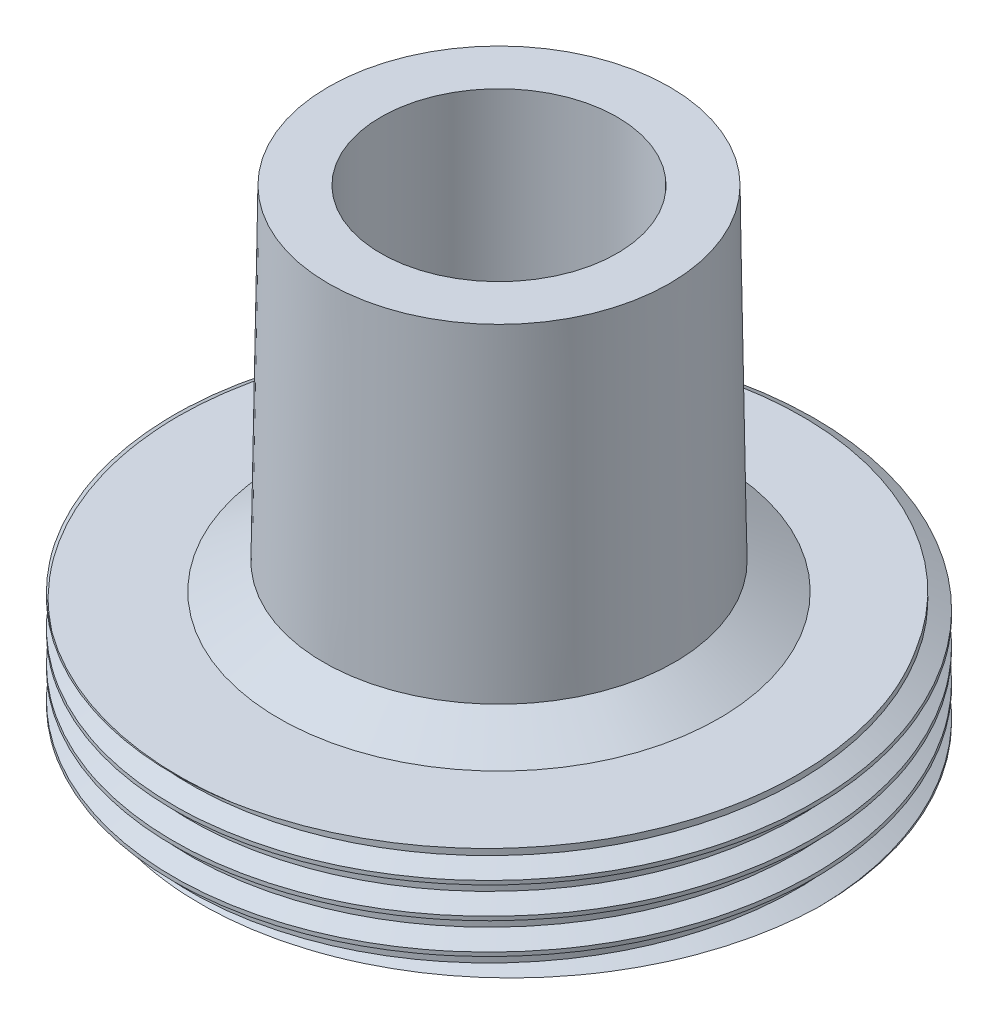
from build123d import *
from build123d.topology import SkipClean

# Parameters (mm, degrees)
SKETCH2_R           = 2.05
CUT_EXTRUDE1_DEPTH  = 37.683579433
CIRPATTERN1_COUNT   = 4
SKETCH3_R           = 3.8
SKETCH3_R_2         = 2.05
BOSS_EXTRUDE1_DEPTH = 3.5
THREAD1_PITCH       = 2


with BuildPart() as part:
    # Sketch1 → Revolve1 (revolve)
    with BuildSketch(Plane.XY, mode=Mode.PRIVATE) as revolve1_sk:
        Polygon((-20.65, 23.985086754), (-18.35, 23.985086754), (-18.35, 30.285086754), (-14.95, 30.285086754), (-14.95, 25.785086754), (-14.25, 25.785086754), (-11.85, 31.785086754), (0, 31.785086754), (0, 33.485086754), (-7.625, 33.485086754), (-7.625, 53.985086754), (-11, 53.985086754), (-11.322325581, 32.985086754), (-14.2, 31.285086754), (-20.65, 31.285086754), align=None)
    revolve(revolve1_sk.sketch.rotate(Axis((0, 0, 0), (0, 1, 0)), 270), axis=Axis((0, 0, 0), (0, 1, 0)))

    # Sketch2 → Cut-Extrude1 (cut, symmetric)
    with BuildSketch(Plane.XZ.offset(-31.785086754)):
        with Locations(Location((0, 0, 0), (0, 0, 270))):
            Circle(SKETCH2_R)
        with BuildLine():
            Line((1.1, 3.637306696), (1.1, 7.343066458))
            ThreePointArc((1.1, 7.343066458), (5.25026785, 5.25026785), (7.343066458, 1.1))
            Line((7.343066458, 1.1), (3.637306696, 1.1))
            ThreePointArc((3.637306696, 1.1), (2.687005769, 2.687005769), (1.1, 3.637306696))
        make_face()
    cut_extrude1 = extrude(amount=CUT_EXTRUDE1_DEPTH, both=True, mode=Mode.SUBTRACT)

    # CirPattern1: Cut-Extrude1 ×4 about axis
    cirpattern1_axis = Axis((0, 0, 0), (0, 1, 0))
    for i in range(1, CIRPATTERN1_COUNT):
        add(cut_extrude1.rotate(cirpattern1_axis, i * 360 / CIRPATTERN1_COUNT), mode=Mode.SUBTRACT)

    # Sketch3 → Boss-Extrude1 (add)
    with SkipClean():  # the faces are left unmerged after this step: merging them gives an invalid solid
        with BuildSketch(Plane(origin=(0, 33.485086754, 0), x_dir=(1, 0, 0), z_dir=(0, 1, 0))):
            with Locations(Location((0, 0, 0), (0, 0, 73.173551107))):
                Circle(SKETCH3_R)
            with Locations(Location((0, 0, 0), (0, 0, 270))):
                Circle(SKETCH3_R_2, mode=Mode.SUBTRACT)
        extrude(amount=BOSS_EXTRUDE1_DEPTH)
    add(part.part.scale(1), mode=Mode.REPLACE)  # the faces are merged on a copy

    # Thread1: the profile of Thread Profile1 profile screwed along a right-hand helix of 5 turns, 10 arcs to a turn; built about Z, then put on its axis
    thread1_z = Axis((0, 0, 0), (0, 0, 1))
    thread1_corners = [(20.6503, 0, -0.000173205), (20.6503, 0, 1.7501732), (19.56746825, 0, 1.124999997), (19.56746825, 0, 0.624999997)]
    with BuildLine(mode=Mode.PRIVATE) as thread1_profile:
        Line(thread1_corners[0], thread1_corners[1])
        Line(thread1_corners[1], thread1_corners[2])
        Line(thread1_corners[2], thread1_corners[3])
        Line(thread1_corners[3], thread1_corners[0])
    thread1_cap = Face(thread1_profile.wire())
    thread1_turn_angles = [0, 18, 36, 54, 72, 90, 108, 126, 144, 162, 180, 198, 216, 234, 252, 270, 288, 306, 324, 342, 360]
    thread1_turn_weights = [1, 0.9510565162951535, 1, 0.9510565162951535, 1, 0.9510565162951535, 1, 0.9510565162951535, 1, 0.9510565162951535, 1, 0.9510565162951535, 1, 0.9510565162951535, 1, 0.9510565162951535, 1, 0.9510565162951535, 1, 0.9510565162951535, 1]
    thread1_turn_rails = [Edge.make_bspline([Vector(p[0], p[1], 0).rotate(thread1_z, thread1_turn_angles[k]) / thread1_turn_weights[k] + Vector(0, 0, p[2] + THREAD1_PITCH * thread1_turn_angles[k] / 360) for k in range(21)], [0, 0, 0, 1, 1, 2, 2, 3, 3, 4, 4, 5, 5, 6, 6, 7, 7, 8, 8, 9, 9, 10, 10, 10], 2, thread1_turn_weights) for p in thread1_corners]
    thread1_turn_sides = [Face.make_surface_from_curves(thread1_turn_rails[p[0]], thread1_turn_rails[p[1]]) for p in [(0, 1), (1, 2), (2, 3), (3, 0)]]
    thread1 = Plane(origin=(0, 21.985086754, 0), x_dir=(1, 0, 0), z_dir=(0, 1, 0)) * Solid(Shell([*[p.moved(Location((0, 0, THREAD1_PITCH * i))) for i in range(5) for p in thread1_turn_sides], thread1_cap, thread1_cap.rotate(thread1_z, 1800).moved(Location((0, 0, THREAD1_PITCH * 1800 / 360)))]))
    add(thread1, mode=Mode.SUBTRACT)


solid = part.part
